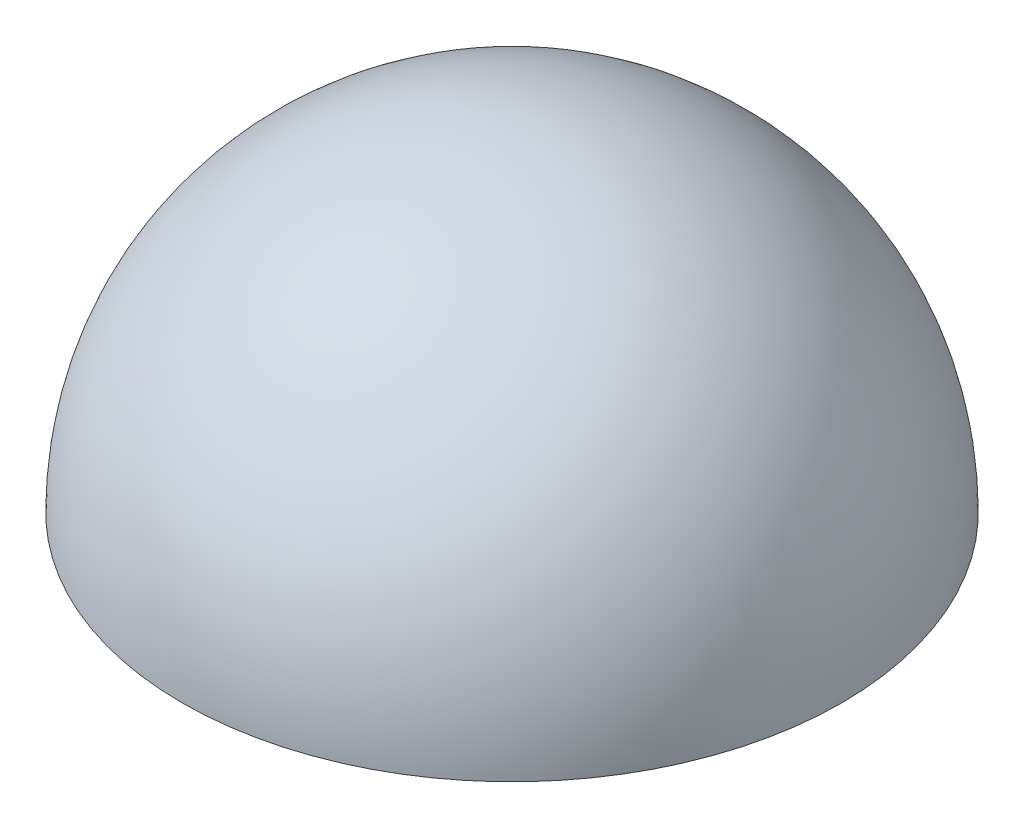
from build123d import *


with BuildPart() as part:
    # 草图1 → 旋转1 (revolve)
    with BuildSketch(Plane.XY):
        with BuildLine():
            ThreePointArc((0, 25), (-17.67766953, 17.67766953), (-25, 0))
            Line((-25, 0), (0, 0))
            Line((0, 0), (0, 25))
        make_face()
    revolve(axis=Axis((0, 0, 0), (0, 1, 0)))


solid = part.part
